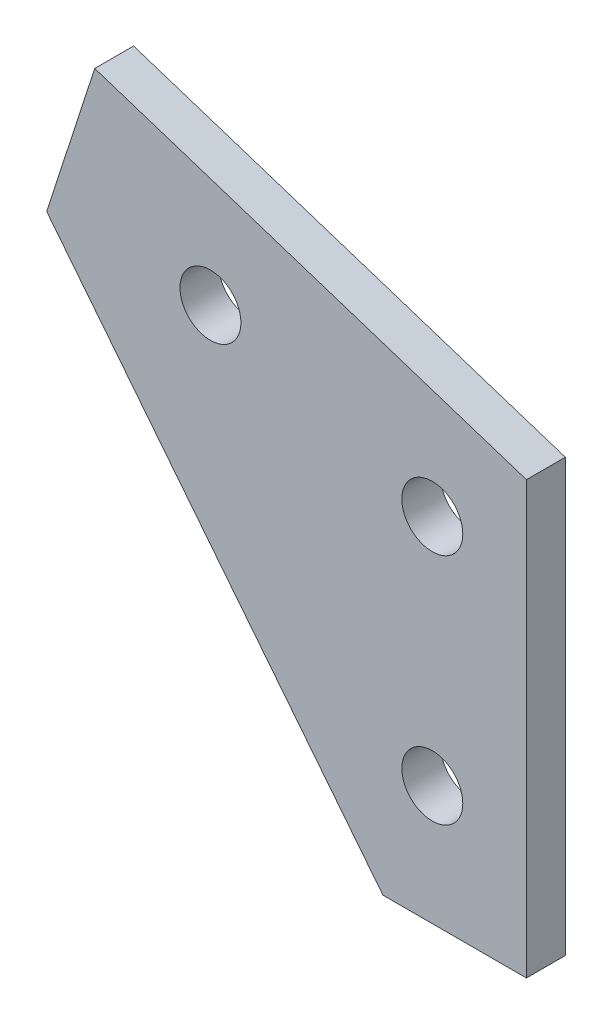
from build123d import *

# Parameters (mm, degrees)
BOSS_EXTRUDE1_DEPTH    = 3.175
F_10_CLEARANCE_HOLE1_D = 4.9784


with BuildPart() as part:
    # Sketch4 → Boss-Extrude1 (new body)
    with BuildSketch(Plane.XY):
        Polygon((-42.188928966, 295.156745567), (-6.933099159, 283.701432055), (-6.933099159, 248.458198081), (-18.653675695, 248.458198081), (-46.113444794, 283.07832781), align=None)
    extrude(amount=BOSS_EXTRUDE1_DEPTH)

    # #10 Clearance Hole1 (through all)
    with Locations(Plane.XY.offset(3.175)):
        with Locations((-32.740251946, 283.138719963), (-14.622625311, 277.25194622), (-14.622625311, 258.20194622)):
            Hole(F_10_CLEARANCE_HOLE1_D / 2)


solid = part.part
